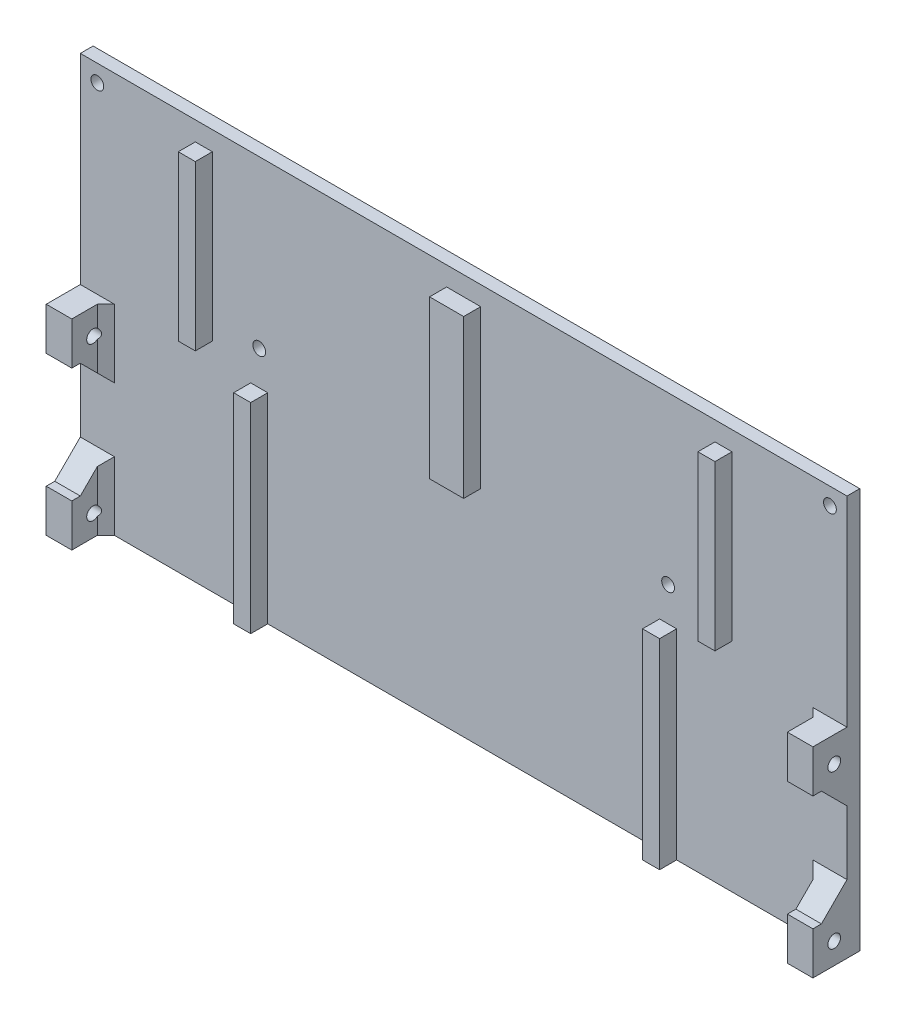
from build123d import *

# Parameters (mm, degrees)
SKETCH_1_W          = 180
SKETCH_1_H          = 94
EXTRUDE_1_DEPTH     = 3
SKETCH_2_W          = 6
SKETCH_2_H          = 10
EXTRUDE_2_DEPTH     = 8
CHAMFER_2_SIZE      = 6
CHAMFER_1_SIZE      = 6
SKETCH_3_R          = 1.5
CUT_EXTRUDE_1_DEPTH = 204.364205307
SKETCH_4_R          = 1.5
CUT_EXTRUDE_2_DEPTH = 204.224014329
SKETCH_5_W          = 4
SKETCH_5_H          = 47
SKETCH_5_H_2        = 38.5
SKETCH_5_W_2        = 8
SKETCH_5_H_3        = 37
EXTRUDE_3_DEPTH     = 4
CHAMFER_3_SIZE      = 2


with BuildPart() as part:
    # Эскиз1 → Бобышка-Вытянуть1 (new body)
    with BuildSketch(Plane.XY):
        with Locations((90, -47)):
            Rectangle(SKETCH_1_W, SKETCH_1_H)
    extrude(amount=EXTRUDE_1_DEPTH)

    # Эскиз2 → Бобышка-Вытянуть2 (add)
    with BuildSketch(Plane.XY.offset(3)):
        with Locations((3, -89)):
            Rectangle(SKETCH_2_W, SKETCH_2_H)
        with Locations((177, -89)):
            Rectangle(SKETCH_2_W, SKETCH_2_H)
        with Locations((3, -52)):
            Rectangle(SKETCH_2_W, SKETCH_2_H)
        with Locations((177, -52)):
            Rectangle(SKETCH_2_W, SKETCH_2_H)
    extrude(amount=EXTRUDE_2_DEPTH)

    # Фаска2
    chamfer_2_edges = [part.edges().sort_by_distance(p)[0] for p in [
        (3, -57, 3),
        (177, -57, 3),
    ]]
    chamfer(chamfer_2_edges, length=CHAMFER_2_SIZE)

    # Фаска1
    chamfer_1_edges = [part.edges().sort_by_distance(p)[0] for p in [
        (3, -84, 3),
        (177, -84, 3),
    ]]
    chamfer(chamfer_1_edges, length=CHAMFER_1_SIZE)

    # Эскиз3 → Вырез-Вытянуть1 (cut, through all)
    with BuildSketch(Plane(origin=(180, 0, 0), x_dir=(0, 0, -1), z_dir=(1, 0, 0))):
        with Locations((-6, -89)):
            Circle(SKETCH_3_R)
        with Locations((-6, -53)):
            Circle(SKETCH_3_R)
    extrude(amount=-CUT_EXTRUDE_1_DEPTH, mode=Mode.SUBTRACT)

    # Эскиз4 → Вырез-Вытянуть2 (cut, through all)
    with BuildSketch(Plane.XY.offset(3)):
        with Locations((4, -4)):
            Circle(SKETCH_4_R)
        with Locations((176, -4)):
            Circle(SKETCH_4_R)
        with Locations((42, -39)):
            Circle(SKETCH_4_R)
        with Locations((138, -39)):
            Circle(SKETCH_4_R)
    extrude(amount=-CUT_EXTRUDE_2_DEPTH, mode=Mode.SUBTRACT)

    # Эскиз5 → Бобышка-Вытянуть3 (add)
    with BuildSketch(Plane.XY.offset(3)):
        with Locations((42, -70.5)):
            Rectangle(SKETCH_5_W, SKETCH_5_H)
        with Locations((138, -70.5)):
            Rectangle(SKETCH_5_W, SKETCH_5_H)
        with Locations((29, -23.75)):
            Rectangle(SKETCH_5_W, SKETCH_5_H_2)
        with Locations((151, -23.75)):
            Rectangle(SKETCH_5_W, SKETCH_5_H_2)
        with Locations((90, -23)):
            Rectangle(SKETCH_5_W_2, SKETCH_5_H_3)
    extrude(amount=EXTRUDE_3_DEPTH)

    # Фаска3
    # the kernel refuses this chamfer: 2 mm, written as the material it adds along each edge
    with BuildSketch(Plane(origin=(6, -72.856634024, 3), x_dir=(0.9996219169112968, 0, -0.02749587661058627), z_dir=(0, -1, 0))) as chamfer_3_piece_1_section:
        Polygon((CHAMFER_3_SIZE * 0.999621916911, CHAMFER_3_SIZE * 0.0274958766106), (-CHAMFER_3_SIZE * 0.0274958766106, CHAMFER_3_SIZE * 0.999621916911), (0, 0), align=None)
    chamfer_3_piece_1 = extrude(amount=21.143365976, mode=Mode.PRIVATE)
    chamfer_3_piece_1 = split(chamfer_3_piece_1, bisect_by=Plane(origin=(6.672348165, -82.469530213, 7.469530213), z_dir=(0, -0.7071067811865476, -0.7071067811865476)), keep=Keep.TOP, mode=Mode.PRIVATE)
    chamfer_3_piece_1 = chamfer_3_piece_1 - Plane(origin=(6.672348165, -89, 6), x_dir=(0, 0, -1), z_dir=(1, 0, 0)) * Cylinder(1.5, 51, mode=Mode.PRIVATE)
    add(chamfer_3_piece_1)
    with BuildSketch(Plane(origin=(174, -94, 3), x_dir=(-0.9996219169112968, 0, -0.02749587661058639), z_dir=(0, 1, 0))) as chamfer_3_piece_2_section:
        Polygon((CHAMFER_3_SIZE * 0.999621916911, CHAMFER_3_SIZE * 0.0274958766106), (-CHAMFER_3_SIZE * 0.0274958766106, CHAMFER_3_SIZE * 0.999621916911), (0, 0), align=None)
    chamfer_3_piece_2 = extrude(amount=21.143365976, mode=Mode.PRIVATE)
    chamfer_3_piece_2 = split(chamfer_3_piece_2, bisect_by=Plane(origin=(173.327651835, -82.469530213, 7.469530213), z_dir=(0, -0.7071067811865476, -0.7071067811865476)), keep=Keep.TOP, mode=Mode.PRIVATE)
    chamfer_3_piece_2 = chamfer_3_piece_2 - Plane(origin=(173.327651835, -89, 6), x_dir=(0, 0, -1), z_dir=(1, 0, 0)) * Cylinder(1.5, 51, mode=Mode.PRIVATE)
    add(chamfer_3_piece_2)
    with BuildSketch(Plane(origin=(6, -47, 3), x_dir=(0.9996219169112968, 0, -0.02749587661058627), z_dir=(0, -1, 0))) as chamfer_3_piece_3_section:
        Polygon((CHAMFER_3_SIZE * 0.999621916911, CHAMFER_3_SIZE * 0.0274958766106), (-CHAMFER_3_SIZE * 0.0274958766106, CHAMFER_3_SIZE * 0.999621916911), (0, 0), align=None)
    chamfer_3_piece_3 = extrude(amount=21.143365976, mode=Mode.PRIVATE)
    chamfer_3_piece_3 = split(chamfer_3_piece_3, bisect_by=Plane(origin=(6.672348166, -58.527104034, 7.472895966), z_dir=(0, 0.7071067811865476, -0.7071067811865476)), keep=Keep.TOP, mode=Mode.PRIVATE)
    chamfer_3_piece_3 = chamfer_3_piece_3 - Plane(origin=(6.672348166, -53, 6), x_dir=(0, 0, -1), z_dir=(1, 0, 0)) * Cylinder(1.5, 51, mode=Mode.PRIVATE)
    add(chamfer_3_piece_3)
    with BuildSketch(Plane(origin=(174, -68.143365976, 3), x_dir=(-0.9996219169112968, 0, -0.02749587661058639), z_dir=(0, 1, 0))) as chamfer_3_piece_4_section:
        Polygon((CHAMFER_3_SIZE * 0.999621916911, CHAMFER_3_SIZE * 0.0274958766106), (-CHAMFER_3_SIZE * 0.0274958766106, CHAMFER_3_SIZE * 0.999621916911), (0, 0), align=None)
    chamfer_3_piece_4 = extrude(amount=21.143365976, mode=Mode.PRIVATE)
    chamfer_3_piece_4 = split(chamfer_3_piece_4, bisect_by=Plane(origin=(173.327651834, -58.527104034, 7.472895966), z_dir=(0, 0.7071067811865476, -0.7071067811865476)), keep=Keep.TOP, mode=Mode.PRIVATE)
    chamfer_3_piece_4 = chamfer_3_piece_4 - Plane(origin=(173.327651834, -53, 6), x_dir=(0, 0, -1), z_dir=(1, 0, 0)) * Cylinder(1.5, 51, mode=Mode.PRIVATE)
    add(chamfer_3_piece_4)


solid = part.part
